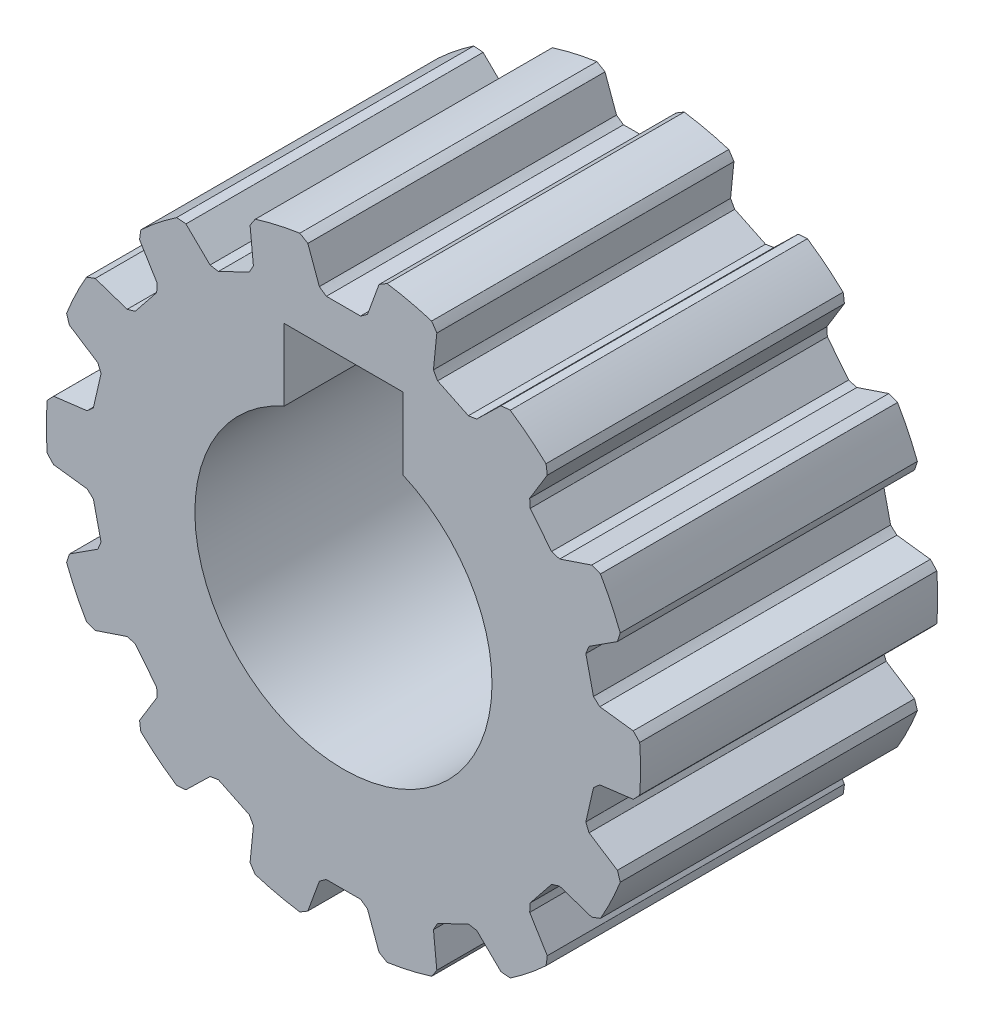
from build123d import *

# Parameters (mm, degrees)
SKETCH1_R           = 10
BOSS_EXTRUDE1_DEPTH = 10
CUT_EXTRUDE1_START  = -10
CUT_EXTRUDE1_DEPTH  = 28.320508076
CIRPATTERN1_COUNT   = 14


with BuildPart() as part:
    # Sketch1 → Boss-Extrude1 (new body)
    with BuildSketch(Plane.XY):
        Circle(SKETCH1_R)
        with BuildLine():
            Line((-2, 7), (2, 7))
            Line((2, 7), (2, 4.582575695))
            ThreePointArc((2, 4.582575695), (0, -5), (-2, 4.582575695))
            Line((-2, 4.582575695), (-2, 7))
        make_face(mode=Mode.SUBTRACT)
    extrude(amount=BOSS_EXTRUDE1_DEPTH)

    # Sketch2 → Cut-Extrude1 (cut)
    with BuildSketch(Plane.XY.offset(10).offset(CUT_EXTRUDE1_START)):
        Polygon((-20.341084154, 62.326061337), (-1.266640021, 9.919456792), (-0.75, 8.5), (0.75, 8.5), (1.266640021, 9.919456792), (20.341084154, 62.326061337), (20.341084154, 173.86594871), (-20.341084154, 173.86594871), align=None)
    cut_extrude1 = extrude(amount=CUT_EXTRUDE1_DEPTH, mode=Mode.SUBTRACT)

    # CirPattern1: Cut-Extrude1 ×14 about axis
    cirpattern1_axis = Axis((0, 0, 10), (0, 0, -1))
    for i in range(1, CIRPATTERN1_COUNT):
        add(cut_extrude1.rotate(cirpattern1_axis, i * 360 / CIRPATTERN1_COUNT), mode=Mode.SUBTRACT)

    # Fillet1
    # a fillet whose section is not a circle: 0.25 mm, written as the material it adds along each edge (its section moved 0.00015 mm through the faces so that the kernel can cut it)
    with BuildSketch(Plane(origin=(-4.363738433, 7.332822573, 0), x_dir=(-0.7164648975365518, 0.6976231436799801, 0), z_dir=(0, 0, 1)), Plane(origin=(-0.75, 8.5, 0), x_dir=(-0.34282522955053096, 0.9393992026735096, 0), z_dir=(0, 0, 1)), Plane(origin=(0.75, 8.5, 0), x_dir=(-0.9999996328709909, -0.0008568884894545356, 0), z_dir=(0, 0, 1)), Plane(origin=(3.012285132, 7.983648182, 0), x_dir=(0.09871517962350768, 0.9951157286024066, 0), z_dir=(0, 0, 1)), Plane(origin=(4.363738433, 7.332822573, 0), x_dir=(-0.9013403271124231, 0.43311154997398804, 0), z_dir=(0, 0, 1)), Plane(origin=(6.17795025, 5.886036928, 0), x_dir=(0.5207038368108623, 0.8537373801881039, 0), z_dir=(0, 0, 1)), Plane(origin=(7.113184952, 4.713289704, 0), x_dir=(-0.6241595153555675, 0.7812969342005018, 0), z_dir=(0, 0, 1)), Plane(origin=(8.119996553, 2.622623873, 0), x_dir=(0.8395607131044042, 0.5432658732256465, 0), z_dir=(0, 0, 1)), Plane(origin=(8.453777954, 1.160232004, 0), x_dir=(-0.2233562567684371, 0.9747368786305317, 0), z_dir=(0, 0, 1)), Plane(origin=(8.453777954, -1.160232004, 0), x_dir=(0.9921322936311259, 0.12519389735223285, 0), z_dir=(0, 0, 1)), Plane(origin=(8.119996553, -2.622623873, 0), x_dir=(0.2216854477564154, 0.975118229884478, 0), z_dir=(0, 0, 1)), Plane(origin=(7.113184952, -4.713289704, 0), x_dir=(0.9481999057001399, -0.31767426529425646, 0), z_dir=(0, 0, 1)), Plane(origin=(6.17795025, -5.886036928, 0), x_dir=(0.622819630559517, 0.7823654566695203, 0), z_dir=(0, 0, 1)), Plane(origin=(4.363738433, -7.332822573, 0), x_dir=(0.7164648975365742, -0.6976231436799574, 0), z_dir=(0, 0, 1)), Plane(origin=(3.012285132, -7.983648182, 0), x_dir=(0.9005967471488001, 0.43465560967851335, 0), z_dir=(0, 0, 1)), Plane(origin=(0.75, -8.5, 0), x_dir=(0.3428252295505342, -0.9393992026735085, 0), z_dir=(0, 0, 1)), Plane(origin=(-0.75, -8.5, 0), x_dir=(0.9999996328709909, 0.0008568884894545356, 0), z_dir=(0, 0, 1)), Plane(origin=(-3.012285132, -7.983648182, 0), x_dir=(-0.09871517962349713, -0.9951157286024077, 0), z_dir=(0, 0, 1)), Plane(origin=(-4.363738433, -7.332822573, 0), x_dir=(0.9013403271124231, -0.43311154997398804, 0), z_dir=(0, 0, 1)), Plane(origin=(-6.17795025, -5.886036928, 0), x_dir=(-0.5207038368108704, -0.8537373801880987, 0), z_dir=(0, 0, 1)), Plane(origin=(-7.113184952, -4.713289704, 0), x_dir=(0.6241595153555656, -0.7812969342005034, 0), z_dir=(0, 0, 1)), Plane(origin=(-8.119996553, -2.622623873, 0), x_dir=(-0.8395607131043998, -0.5432658732256536, 0), z_dir=(0, 0, 1)), Plane(origin=(-8.453777954, -1.160232004, 0), x_dir=(0.22335625676841697, -0.9747368786305363, 0), z_dir=(0, 0, 1)), Plane(origin=(-8.453777954, 1.160232004, 0), x_dir=(-0.9921322936311271, -0.12519389735222275, 0), z_dir=(0, 0, 1)), Plane(origin=(-8.119996553, 2.622623873, 0), x_dir=(-0.22168544775642668, -0.9751182298844754, 0), z_dir=(0, 0, 1)), Plane(origin=(-7.113184952, 4.713289704, 0), x_dir=(-0.9481999057001594, 0.31767426529419857, 0), z_dir=(0, 0, 1)), Plane(origin=(-6.17795025, 5.886036928, 0), x_dir=(-0.6228196305595144, -0.7823654566695222, 0), z_dir=(0, 0, 1))) as fillet1_piece_1:
        with BuildLine():
            Bezier((0.175051949, 0), (-0.000104903, 0.00015009), (-0.060153112, -0.164392177), weights=[1, 0.020478801, 1])
            Line((-0.060153112, -0.164392177), (-0.064850108, -0.162678051))
            ThreePointArc((-0.064850108, -0.162678051), (-0.034703097, -0.080507674), (-0.004696996, 0.001714126))
            Line((-0.004696996, 0.001714126), (4.284e-06, 0.004999998))
            ThreePointArc((4.284e-06, 0.004999998), (0.087530195, 0.004924998), (0.175056233, 0.004999998))
            Line((0.175056233, 0.004999998), (0.175051949, 0))
        make_face()
    extrude(amount=10)
    with BuildSketch(Plane(origin=(-3.012285132, 7.983648182, 0), x_dir=(-0.09871517962350324, 0.995115728602407, 0), z_dir=(0, 0, 1))) as fillet1_piece_2:
        with BuildLine():
            Bezier((0.175051949, 0), (-0.000104903, -0.00015009), (-0.060153112, 0.164392177), weights=[1, 0.020478801, 1])
            Line((-0.060153112, 0.164392177), (-0.064850108, 0.162678051))
            ThreePointArc((-0.064850108, 0.162678051), (-0.034703097, 0.080507674), (-0.004696996, -0.001714126))
            Line((-0.004696996, -0.001714126), (4.284e-06, -0.004999998))
            ThreePointArc((4.284e-06, -0.004999998), (0.087530195, -0.004924998), (0.175056233, -0.004999998))
            Line((0.175056233, -0.004999998), (0.175051949, 0))
        make_face()
    extrude(amount=10)
    # a fillet whose section is not a circle: 0.25 mm, written as the material it takes off along each edge (its section moved 0.00015 mm through the faces so that the kernel can cut it)
    with BuildSketch(Plane(origin=(-3.162687777, 9.486696265, 10.511278669), x_dir=(0.9516289467484346, 0.30724965046434954, 0), z_dir=(0, 0, -1))) as fillet1_2_piece_1:
        with BuildLine():
            Bezier((0.204511468, 0), (0.000329515, -0.002237738), (-0.042749586, 0.19736053), weights=[1, 0.019366904, 1])
            Line((-0.042749586, 0.19736053), (-0.047637048, 0.196305673))
            ThreePointArc((-0.047637048, 0.196305673), (-0.026188943, 0.097641232), (-0.004887461, -0.001054856))
            Line((-0.004887461, -0.001054856), (-4.7461e-05, -0.004999775))
            ThreePointArc((-4.7461e-05, -0.004999775), (0.10225973, -0.00544782), (0.204566262, -0.0049997))
            Line((0.204566262, -0.0049997), (0.204511468, 0))
        make_face()
    extrude(amount=11.022557338, mode=Mode.SUBTRACT)
    with BuildSketch(Plane(origin=(-1.266640021, 9.919456792, 10.511278669), x_dir=(-0.9906986820011439, -0.1360739559254318, 0), z_dir=(0, 0, -1)), Plane(origin=(6.965606473, 7.174979196, 10.511278669), x_dir=(-0.7240774276290741, 0.6897186954099932, 0), z_dir=(0, 0, -1)), Plane(origin=(9.38890138, 3.442169501, 10.511278669), x_dir=(-0.35311349374089435, 0.9355804938849994, 0), z_dir=(0, 0, -1)), Plane(origin=(9.952609221, -0.972404078, 10.511278669), x_dir=(0.08778889823547595, 0.9961391014043175, 0), z_dir=(0, 0, -1)), Plane(origin=(8.545080745, -5.194381104, 10.511278669), x_dir=(0.511303622256116, 0.8594001430461686, 0), z_dir=(0, 0, -1)), Plane(origin=(5.445094229, -8.387547248, 10.511278669), x_dir=(0.8335483931615351, 0.5524464465066482, 0), z_dir=(0, 0, -1)), Plane(origin=(1.266640021, -9.919456792, 10.511278669), x_dir=(0.9906986820011419, 0.13607395592544683, 0), z_dir=(0, 0, -1)), Plane(origin=(-3.162687777, -9.486696265, 10.511278669), x_dir=(0.9516289467484369, -0.3072496504643423, 0), z_dir=(0, 0, -1)), Plane(origin=(-6.965606473, -7.174979196, 10.511278669), x_dir=(0.7240774276290806, -0.6897186954099863, 0), z_dir=(0, 0, -1)), Plane(origin=(-9.38890138, -3.442169501, 10.511278669), x_dir=(0.35311349374089107, -0.9355804938850006, 0), z_dir=(0, 0, -1)), Plane(origin=(-9.952609221, 0.972404078, 10.511278669), x_dir=(-0.08778889823547563, -0.9961391014043177, 0), z_dir=(0, 0, -1)), Plane(origin=(-8.545080745, 5.194381104, 10.511278669), x_dir=(-0.5113036222561212, -0.8594001430461655, 0), z_dir=(0, 0, -1)), Plane(origin=(-5.445094229, 8.387547248, 10.511278669), x_dir=(-0.8335483931615338, -0.5524464465066502, 0), z_dir=(0, 0, -1)), Plane(origin=(3.162687777, 9.486696265, 10.511278669), x_dir=(-0.9516289467484393, 0.3072496504643351, 0), z_dir=(0, 0, -1))) as fillet1_2_piece_2:
        with BuildLine():
            Bezier((0.204511468, 0), (0.000329515, 0.002237738), (-0.042749586, -0.19736053), weights=[1, 0.019366904, 1])
            Line((-0.042749586, -0.19736053), (-0.047637048, -0.196305673))
            ThreePointArc((-0.047637048, -0.196305673), (-0.026188943, -0.097641232), (-0.004887461, 0.001054856))
            Line((-0.004887461, 0.001054856), (-4.7461e-05, 0.004999775))
            ThreePointArc((-4.7461e-05, 0.004999775), (0.10225973, 0.00544782), (0.204566262, 0.0049997))
            Line((0.204566262, 0.0049997), (0.204511468, 0))
        make_face()
    extrude(amount=11.022557338, mode=Mode.SUBTRACT)
    with BuildSketch(Plane(origin=(1.266640021, 9.919456792, 10.511278669), x_dir=(-0.3427180568994124, -0.9394383074343365, 0), z_dir=(0, 0, -1)), Plane(origin=(5.445094229, 8.387547248, 10.511278669), x_dir=(-0.7163853052342616, -0.6977048763226568, 0), z_dir=(0, 0, -1)), Plane(origin=(8.545080745, 5.194381104, 10.511278669), x_dir=(-0.9481636579782666, -0.31778243766651515, 0), z_dir=(0, 0, -1)), Plane(origin=(9.952609221, 0.972404078, 10.511278669), x_dir=(-0.992146569795535, 0.12508071011532315, 0), z_dir=(0, 0, -1)), Plane(origin=(9.38890138, -3.442169501, 10.511278669), x_dir=(-0.839622685585634, 0.5431700892445824, 0), z_dir=(0, 0, -1)), Plane(origin=(6.965606473, -7.174979196, 10.511278669), x_dir=(-0.5208012311990234, 0.8536779706549662, 0), z_dir=(0, 0, -1)), Plane(origin=(3.162687777, -9.486696265, 10.511278669), x_dir=(-0.09882870576550205, 0.9951044603038999, 0), z_dir=(0, 0, -1)), Plane(origin=(-1.266640021, -9.919456792, 10.511278669), x_dir=(0.3427180568994106, 0.9394383074343373, 0), z_dir=(0, 0, -1)), Plane(origin=(-5.445094229, -8.387547248, 10.511278669), x_dir=(0.7163853052342596, 0.6977048763226589, 0), z_dir=(0, 0, -1)), Plane(origin=(-8.545080745, -5.194381104, 10.511278669), x_dir=(0.9481636579782667, 0.31778243766651526, 0), z_dir=(0, 0, -1)), Plane(origin=(-9.952609221, -0.972404078, 10.511278669), x_dir=(0.9921465697955348, -0.12508071011532534, 0), z_dir=(0, 0, -1)), Plane(origin=(-9.38890138, 3.442169501, 10.511278669), x_dir=(0.8396226855856366, -0.5431700892445783, 0), z_dir=(0, 0, -1)), Plane(origin=(-6.965606473, 7.174979196, 10.511278669), x_dir=(0.520801231199023, -0.8536779706549665, 0), z_dir=(0, 0, -1))) as fillet1_2_piece_3:
        with BuildLine():
            Bezier((0.201937381, 0), (-0.002256778, 0.000151676), (-0.043294513, -0.199876275), weights=[1, 0.019366904, 1])
            Line((-0.043294513, -0.199876275), (-0.048192496, -0.198871405))
            ThreePointArc((-0.048192496, -0.198871405), (-0.026972449, -0.098788755), (-0.004876409, 0.001104823))
            Line((-0.004876409, 0.001104823), (3.714e-06, 0.004999999))
            ThreePointArc((3.714e-06, 0.004999999), (0.100972349, 0.004924999), (0.201941095, 0.004999999))
            Line((0.201941095, 0.004999999), (0.201937381, 0))
        make_face()
    extrude(amount=11.022557338, mode=Mode.SUBTRACT)


solid = part.part
